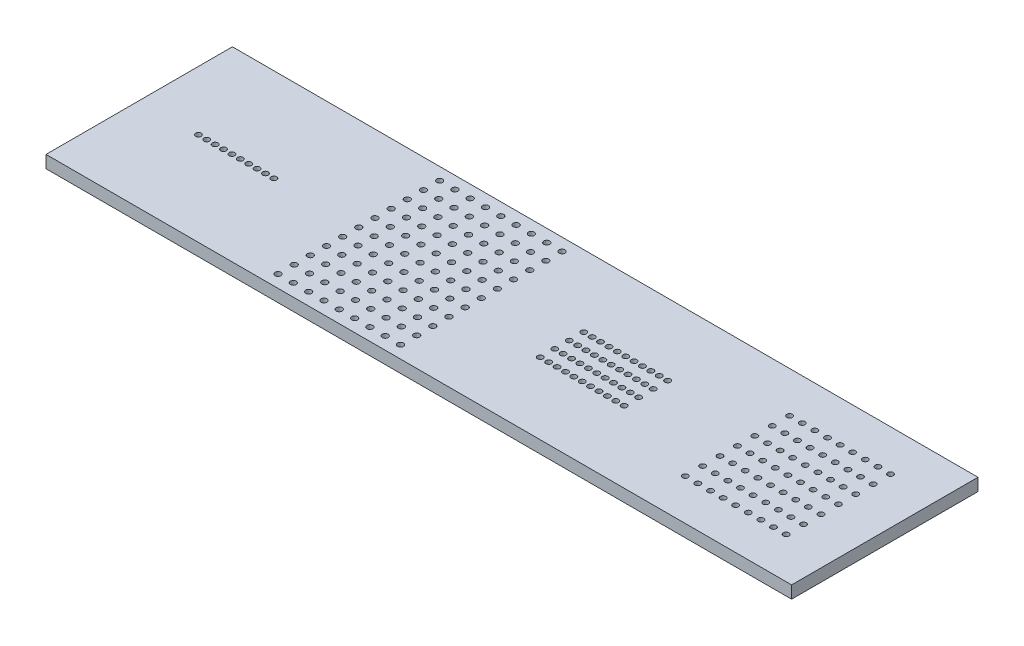
from build123d import *

# Parameters (mm, degrees)
ESQUISSE2_W                     = 120
ESQUISSE2_H                     = 30
BOSS_EXTRU_1_DEPTH              = 2
ENL_V_MAT_EXTRU_3_REACH         = 63.879
ESQUISSE8_R                     = 0.45
R_P_TITION_LIN_AIRE4_COUNT      = 10
R_P_TITION_LIN_AIRE4_PITCH      = 1.35
ENL_V_MAT_EXTRU_4_REACH         = 63.879
ESQUISSE10_R                    = 0.475
R_P_TITION_LIN_AIRE5_COUNT      = 9
R_P_TITION_LIN_AIRE5_PITCH      = 2.464
R_P_TITION_LIN_AIRE5_COUNT_DIR2 = 11
R_P_TITION_LIN_AIRE5_PITCH_DIR2 = 2.6
ENL_V_MAT_EXTRU_5_REACH         = 63.879
ESQUISSE12_R                    = 0.45
R_P_TITION_LIN_AIRE6_COUNT      = 11
R_P_TITION_LIN_AIRE6_PITCH      = 1.35
R_P_TITION_LIN_AIRE6_COUNT_DIR2 = 4
R_P_TITION_LIN_AIRE6_PITCH_DIR2 = 2.333
ENL_V_MAT_EXTRU_6_REACH         = 63.879
ESQUISSE14_R                    = 0.45
R_P_TITION_LIN_AIRE7_COUNT      = 9
R_P_TITION_LIN_AIRE7_PITCH      = 2.03
R_P_TITION_LIN_AIRE7_COUNT_DIR2 = 7
R_P_TITION_LIN_AIRE7_PITCH_DIR2 = 2.8


with BuildPart() as part:
    # Esquisse2 → Boss.-Extru.1 (new body)
    with BuildSketch(Plane(origin=(0, 0, 0), x_dir=(1, 0, 0), z_dir=(0, 1, 0))):
        Rectangle(ESQUISSE2_W, ESQUISSE2_H)
    extrude(amount=BOSS_EXTRU_1_DEPTH)

    # Esquisse8 → Enlèv. mat.-Extru.3 (cut, up to next)
    with BuildSketch(Plane(origin=(0, 2, 0), x_dir=(1, 0, 0), z_dir=(0, 1, 0)), mode=Mode.PRIVATE) as enl_v_mat_extru_3_sk1:
        with Locations((-50.475, 0)):
            Circle(ESQUISSE8_R)
    enl_v_mat_extru_3_tool1 = extrude(enl_v_mat_extru_3_sk1.sketch, amount=-ENL_V_MAT_EXTRU_3_REACH, mode=Mode.PRIVATE) & part.part
    enl_v_mat_extru_3 = enl_v_mat_extru_3_tool1.solids().sort_by_distance((-50.475, 2, 0))[0]
    add(enl_v_mat_extru_3, mode=Mode.SUBTRACT)

    # Répétition linéaire4: Enlèv. mat.-Extru.3 ×10
    with Locations(*[(i * R_P_TITION_LIN_AIRE4_PITCH, 0, 0) for i in range(1, R_P_TITION_LIN_AIRE4_COUNT)]):
        add(enl_v_mat_extru_3, mode=Mode.SUBTRACT)

    # Esquisse10 → Enlèv. mat.-Extru.4 (cut, up to next)
    with BuildSketch(Plane(origin=(0, 2, 0), x_dir=(1, 0, 0), z_dir=(0, 1, 0)), mode=Mode.PRIVATE) as enl_v_mat_extru_4_sk1:
        with Locations((-24.656, 13)):
            Circle(ESQUISSE10_R)
    enl_v_mat_extru_4_tool1 = extrude(enl_v_mat_extru_4_sk1.sketch, amount=-ENL_V_MAT_EXTRU_4_REACH, mode=Mode.PRIVATE) & part.part
    enl_v_mat_extru_4 = enl_v_mat_extru_4_tool1.solids().sort_by_distance((-24.656, 2, -13))[0]
    add(enl_v_mat_extru_4, mode=Mode.SUBTRACT)

    # Répétition linéaire5: Enl_v. mat.-Extru.4 9 × 11
    with Locations(*[(i * R_P_TITION_LIN_AIRE5_PITCH, 0, j * R_P_TITION_LIN_AIRE5_PITCH_DIR2) for i in range(R_P_TITION_LIN_AIRE5_COUNT) for j in range(R_P_TITION_LIN_AIRE5_COUNT_DIR2) if (i, j) != (0, 0)]):
        add(enl_v_mat_extru_4, mode=Mode.SUBTRACT)

    # Esquisse12 → Enlèv. mat.-Extru.5 (cut, up to next)
    with BuildSketch(Plane(origin=(0, 2, 0), x_dir=(1, 0, 0), z_dir=(0, 1, 0)), mode=Mode.PRIVATE) as enl_v_mat_extru_5_sk1:
        with Locations((8.05, 3.4995)):
            Circle(ESQUISSE12_R)
    enl_v_mat_extru_5_tool1 = extrude(enl_v_mat_extru_5_sk1.sketch, amount=-ENL_V_MAT_EXTRU_5_REACH, mode=Mode.PRIVATE) & part.part
    enl_v_mat_extru_5 = enl_v_mat_extru_5_tool1.solids().sort_by_distance((8.05, 2, -3.4995))[0]
    add(enl_v_mat_extru_5, mode=Mode.SUBTRACT)

    # Répétition linéaire6: Enl_v. mat.-Extru.5 11 × 4
    with Locations(*[(i * R_P_TITION_LIN_AIRE6_PITCH, 0, j * R_P_TITION_LIN_AIRE6_PITCH_DIR2) for i in range(R_P_TITION_LIN_AIRE6_COUNT) for j in range(R_P_TITION_LIN_AIRE6_COUNT_DIR2) if (i, j) != (0, 0)]):
        add(enl_v_mat_extru_5, mode=Mode.SUBTRACT)

    # Esquisse14 → Enlèv. mat.-Extru.6 (cut, up to next)
    with BuildSketch(Plane(origin=(0, 2, 0), x_dir=(1, 0, 0), z_dir=(0, 1, 0)), mode=Mode.PRIVATE) as enl_v_mat_extru_6_sk1:
        with Locations((36.28, 8.4)):
            Circle(ESQUISSE14_R)
    enl_v_mat_extru_6_tool1 = extrude(enl_v_mat_extru_6_sk1.sketch, amount=-ENL_V_MAT_EXTRU_6_REACH, mode=Mode.PRIVATE) & part.part
    enl_v_mat_extru_6 = enl_v_mat_extru_6_tool1.solids().sort_by_distance((36.28, 2, -8.4))[0]
    add(enl_v_mat_extru_6, mode=Mode.SUBTRACT)

    # Répétition linéaire7: Enl_v. mat.-Extru.6 9 × 7
    with Locations(*[(i * R_P_TITION_LIN_AIRE7_PITCH, 0, j * R_P_TITION_LIN_AIRE7_PITCH_DIR2) for i in range(R_P_TITION_LIN_AIRE7_COUNT) for j in range(R_P_TITION_LIN_AIRE7_COUNT_DIR2) if (i, j) != (0, 0)]):
        add(enl_v_mat_extru_6, mode=Mode.SUBTRACT)


solid = part.part
